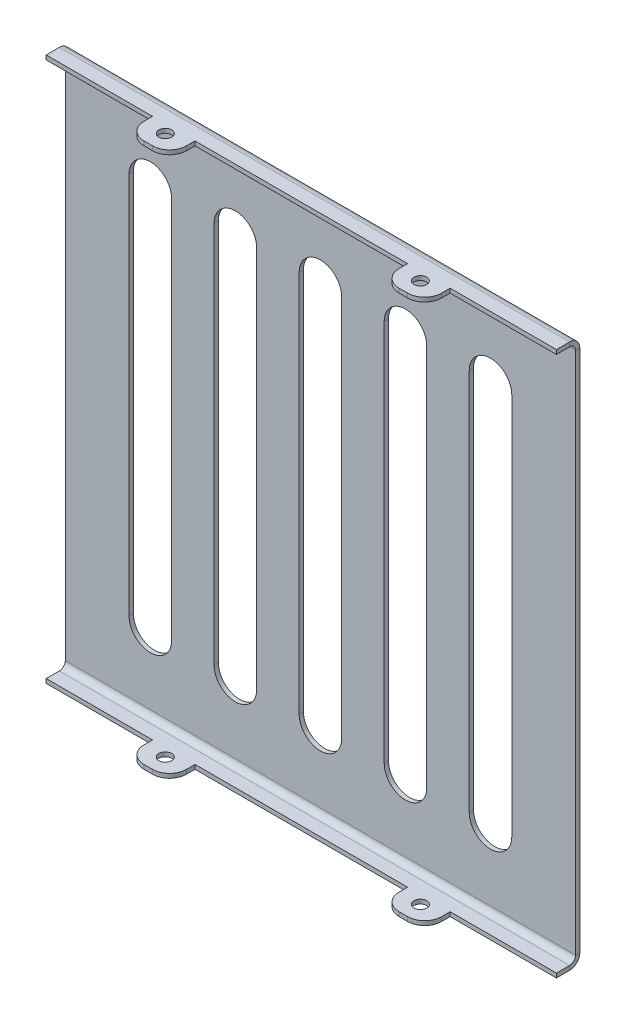
from build123d import *

# Parameters (mm, degrees)
CROQUIS1_W                      = 64
CROQUIS1_H                      = 120
CROQUIS1_R                      = 1.5
CROQUIS1_W_2                    = 2
CROQUIS1_H_2                    = 40
SALIENTE_EXTRUIR1_DEPTH         = 1
PLIEGUE_START                   = 63.746512
PLIEGUE_CROQUIZADO1_OUTLINE_W   = 120
PLIEGUE_CROQUIZADO1_OUTLINE_H   = 1
PLIEGUE_CROQUIZADO1_DEPTH       = 9.933488
PLIEGUE_START_2                 = 62.786512
PLIEGUE_CROQUIZADO1_2_OUTLINE_R = 1.5
PLIEGUE_CROQUIZADO1_2_DEPTH     = 1.213488
PLIEGUE_START_3                 = -121
PLIEGUE_CROQUIZADO1_3_DEPTH     = 122
PLIEGUE_START_4                 = -120
PLIEGUE_CROQUIZADO1_4_DEPTH     = 120
CORTAR_EXTRUIR1_REACH           = 138.485
CORTAR_EXTRUIR2_DEPTH           = 184
REDONDEO1_R                     = 4


with BuildPart() as part:
    # Croquis1 → Saliente-Extruir1 (new body)
    # profile 1 of 5: a face of its own
    with BuildSketch(Plane(origin=(0, 0, 0), x_dir=(0, 1, 0), z_dir=(0, 0, 1))):
        with Locations((32, 60)):
            Rectangle(CROQUIS1_W, CROQUIS1_H)
    # profile 2 of 5: a face of its own
    with BuildSketch(Plane(origin=(0, 0, 0), x_dir=(0, 1, 0), z_dir=(0, 0, 1))):
        Polygon((64, 120), (64, 0), (67.68, 0), (67.68, 25), (67.68, 40), (67.68, 80), (67.68, 95), (67.68, 120), align=None)
    # profile 3 of 5: a face of its own
    with BuildSketch(Plane(origin=(0, 0, 0), x_dir=(0, 1, 0), z_dir=(0, 0, 1))):
        Polygon((67.68, 40), (67.68, 25), (73.68, 25), (73.68, 40), (69.68, 40), align=None)
        with Locations(Location((69.68, 30, 0), (0, 0, 270))):
            Circle(CROQUIS1_R, mode=Mode.SUBTRACT)
    # profile 4 of 5: a face of its own
    with BuildSketch(Plane(origin=(0, 0, 0), x_dir=(0, 1, 0), z_dir=(0, 0, 1))):
        Polygon((73.68, 95), (67.68, 95), (67.68, 80), (69.68, 80), (73.68, 80), align=None)
        with Locations(Location((69.68, 90, 0), (0, 0, 270))):
            Circle(CROQUIS1_R, mode=Mode.SUBTRACT)
    # profile 5 of 5: a face of its own
    with BuildSketch(Plane(origin=(0, 0, 0), x_dir=(0, 1, 0), z_dir=(0, 0, 1))):
        with Locations((68.68, 60)):
            Rectangle(CROQUIS1_W_2, CROQUIS1_H_2)
    extrude(amount=SALIENTE_EXTRUIR1_DEPTH)

    # Pliegue croquizado1: read off the stored shape, not the designer's step
    # Pliegue croquizado1 outline → Pliegue croquizado1 (cut)
    with BuildSketch(Plane(origin=(0, 0, 0), x_dir=(1, 0, 0), z_dir=(0, 1, 0)).offset(PLIEGUE_START)):
        with Locations((-60, -0.5)):
            Rectangle(PLIEGUE_CROQUIZADO1_OUTLINE_W, PLIEGUE_CROQUIZADO1_OUTLINE_H)
    extrude(amount=PLIEGUE_CROQUIZADO1_DEPTH, mode=Mode.SUBTRACT)

    # Pliegue croquizado1 2 outline → Pliegue croquizado1 2 (add)
    with BuildSketch(Plane(origin=(0, 0, 0), x_dir=(1, 0, 0), z_dir=(0, 1, 0)).offset(PLIEGUE_START_2)):
        Polygon((-95, -11.495486979), (-80, -11.495486979), (-80, -7.495486979), (-40, -7.495486979), (-40, -11.495486979), (-25, -11.495486979), (-25, -5.495486979), (0, -5.495486979), (0, -1), (-120, -1), (-120, -5.495486979), (-95, -5.495486979), align=None)
        with Locations((-90, -7.495486979)):
            Circle(PLIEGUE_CROQUIZADO1_2_OUTLINE_R, mode=Mode.SUBTRACT)
        with Locations((-30, -7.495486979)):
            Circle(PLIEGUE_CROQUIZADO1_2_OUTLINE_R, mode=Mode.SUBTRACT)
    extrude(amount=PLIEGUE_CROQUIZADO1_2_DEPTH)

    # Pliegue croquizado1 3 outline → Pliegue croquizado1 3 (cut)
    with BuildSketch(Plane.YZ.offset(PLIEGUE_START_3)):
        with BuildLine():
            Line((63, 11.495486979), (62.786512, 11.495486979))
            Line((62.786512, 11.495486979), (62.786512, 1.656905608))
            ThreePointArc((62.786512, 1.656905608), (62.945569917, 2.013423228), (63, 2.4))
            Line((63, 2.4), (63, 11.495486979))
        make_face()
        with BuildLine():
            Line((64, 1), (64, 2.4))
            ThreePointArc((64, 2.4), (63.297056275, 0.702943725), (61.6, 0))
            Line((61.6, 0), (63.746512, 0))
            Line((63.746512, 0), (63.746512, 1))
            Line((63.746512, 1), (64, 1))
        make_face()
    extrude(amount=PLIEGUE_CROQUIZADO1_3_DEPTH, mode=Mode.SUBTRACT)

    # Pliegue croquizado1 4 outline → Pliegue croquizado1 4 (add)
    with BuildSketch(Plane.YZ.offset(PLIEGUE_START_4)):
        with BuildLine():
            Line((62.786512, 1), (62.786512, 1.656905608))
            ThreePointArc((62.786512, 1.656905608), (62.278110556, 1.175187331), (61.6, 1))
            Line((61.6, 1), (62.786512, 1))
        make_face()
    extrude(amount=PLIEGUE_CROQUIZADO1_4_DEPTH)

    # Simetría1: part across plane


with BuildPart() as part_1:
    add(part.part)
    add(part.part.mirror(Plane(origin=(0, 0, 1), x_dir=(0, 0, 1), z_dir=(0, 1, 0))))

    # Croquis7 → Cortar-Extruir1 (cut, up to next)
    with BuildSketch(Plane(origin=(0, 0, 0), x_dir=(-1, 0, 0), z_dir=(0, 0, -1)), mode=Mode.PRIVATE) as cortar_extruir1_sk1:
        with BuildLine():
            Line((35, 45.000000776), (35, -45.000000776))
            ThreePointArc((35, -45.000000776), (40.000000388, -50), (45, -45))
            Line((45, -45), (45, 45))
            ThreePointArc((45, 45), (40.000000388, 50), (35, 45.000000776))
        make_face()
    cortar_extruir1_tool1 = extrude(cortar_extruir1_sk1.sketch, amount=-CORTAR_EXTRUIR1_REACH, mode=Mode.PRIVATE) & part_1.part
    # Croquis7 → Cortar-Extruir1 (cut, up to next)
    with BuildSketch(Plane(origin=(0, 0, 0), x_dir=(-1, 0, 0), z_dir=(0, 0, -1)), mode=Mode.PRIVATE) as cortar_extruir1_sk2:
        with BuildLine():
            Line((15, 45.000000776), (15, -45.000000776))
            ThreePointArc((15, -45.000000776), (20.000000388, -50), (25, -45))
            Line((25, -45), (25, 45))
            ThreePointArc((25, 45), (20.000000388, 50), (15, 45.000000776))
        make_face()
    cortar_extruir1_tool2 = extrude(cortar_extruir1_sk2.sketch, amount=-CORTAR_EXTRUIR1_REACH, mode=Mode.PRIVATE) & part_1.part
    # Croquis7 → Cortar-Extruir1 (cut, up to next)
    with BuildSketch(Plane(origin=(0, 0, 0), x_dir=(-1, 0, 0), z_dir=(0, 0, -1)), mode=Mode.PRIVATE) as cortar_extruir1_sk3:
        with BuildLine():
            Line((55, 45.000000776), (55, -45.000000776))
            ThreePointArc((55, -45.000000776), (60.000000388, -50), (65, -45))
            Line((65, -45), (65, 45))
            ThreePointArc((65, 45), (60.000000388, 50), (55, 45.000000776))
        make_face()
    cortar_extruir1_tool3 = extrude(cortar_extruir1_sk3.sketch, amount=-CORTAR_EXTRUIR1_REACH, mode=Mode.PRIVATE) & part_1.part
    # Croquis7 → Cortar-Extruir1 (cut, up to next)
    with BuildSketch(Plane(origin=(0, 0, 0), x_dir=(-1, 0, 0), z_dir=(0, 0, -1)), mode=Mode.PRIVATE) as cortar_extruir1_sk4:
        with BuildLine():
            Line((75, 45.000000776), (75, -45.000000776))
            ThreePointArc((75, -45.000000776), (80.000000388, -50), (85, -45))
            Line((85, -45), (85, 45))
            ThreePointArc((85, 45), (80.000000388, 50), (75, 45.000000776))
        make_face()
    cortar_extruir1_tool4 = extrude(cortar_extruir1_sk4.sketch, amount=-CORTAR_EXTRUIR1_REACH, mode=Mode.PRIVATE) & part_1.part
    # Croquis7 → Cortar-Extruir1 (cut, up to next)
    with BuildSketch(Plane(origin=(0, 0, 0), x_dir=(-1, 0, 0), z_dir=(0, 0, -1)), mode=Mode.PRIVATE) as cortar_extruir1_sk5:
        with BuildLine():
            Line((95, 45.000000776), (95, -45.000000776))
            ThreePointArc((95, -45.000000776), (100.000000388, -50), (105, -45))
            Line((105, -45), (105, 45))
            ThreePointArc((105, 45), (100.000000388, 50), (95, 45.000000776))
        make_face()
    cortar_extruir1_tool5 = extrude(cortar_extruir1_sk5.sketch, amount=-CORTAR_EXTRUIR1_REACH, mode=Mode.PRIVATE) & part_1.part
    add(cortar_extruir1_tool1.solids().sort_by_distance((-40, 0, 0))[0], mode=Mode.SUBTRACT)
    add(cortar_extruir1_tool2.solids().sort_by_distance((-20, 0, 0))[0], mode=Mode.SUBTRACT)
    add(cortar_extruir1_tool3.solids().sort_by_distance((-60, 0, 0))[0], mode=Mode.SUBTRACT)
    add(cortar_extruir1_tool4.solids().sort_by_distance((-80, 0, 0))[0], mode=Mode.SUBTRACT)
    add(cortar_extruir1_tool5.solids().sort_by_distance((-100, 0, 0))[0], mode=Mode.SUBTRACT)

    # Croquis8 → Cortar-Extruir2 (cut)
    with BuildSketch(Plane.XZ.offset(64)):
        Polygon((-80, 11.495486979), (-85, 11.495486979), (-85, 5.495486979), (-80, 5.495486979), (-40, 5.495486979), (-35, 5.495486979), (-35, 11.495486979), (-40, 11.495486979), (-40, 7.495486979), (-80, 7.495486979), align=None)
    extrude(amount=-CORTAR_EXTRUIR2_DEPTH, mode=Mode.SUBTRACT)

    # Redondeo1
    redondeo1_edges = [part_1.edges().sort_by_distance(p)[0] for p in [
        (-95, -63.5, 11.495486979),
        (-25, -63.5, 11.495486979),
        (-25, 63.5, 11.495486979),
        (-95, 63.5, 11.495486979),
        (-35, 63.5, 11.495486979),
        (-85, 63.5, 11.495486979),
        (-35, -63.5, 11.495486979),
        (-85, -63.5, 11.495486979),
    ]]
    fillet(redondeo1_edges, radius=REDONDEO1_R)


solid = part_1.part
